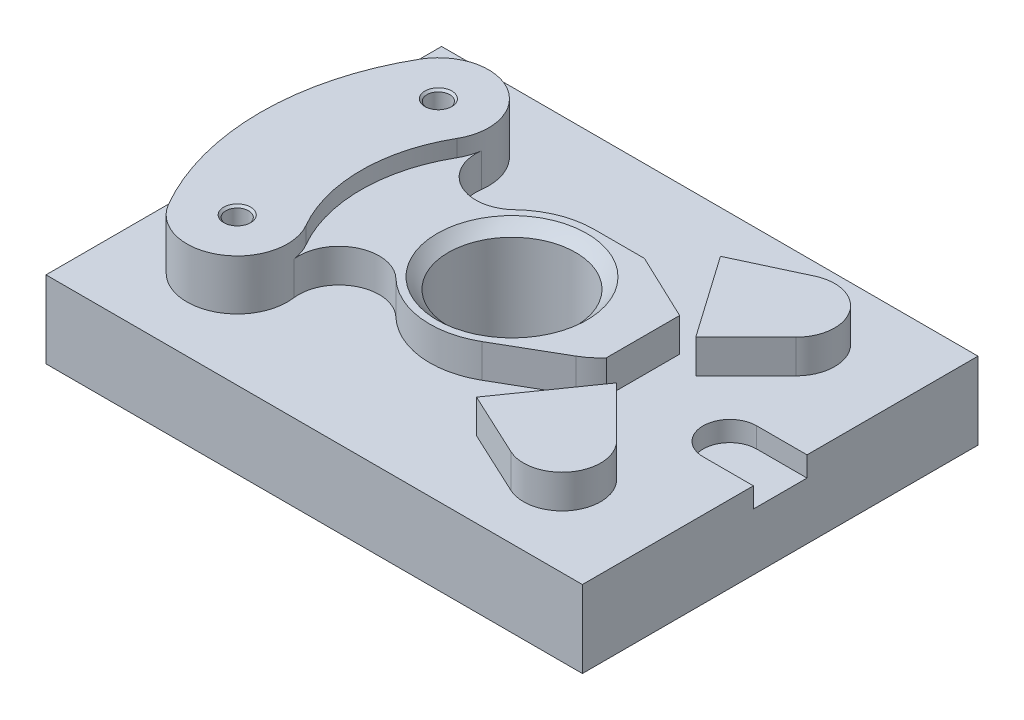
from build123d import *

# Parameters (mm, degrees)
SKETCH_1_W                   = 160
SKETCH_1_H                   = 118
EXTRUDE_1_DEPTH              = 23
EXTRUDE_2_DEPTH              = 38
HOLE_WIZARD_M8_2_D           = 6.8
HOLE_WIZARD_M8_2_DEPTH       = 17.957073895
HOLE_WIZARD_M8_2_CSINK_D     = 8.05
HOLE_WIZARD_M8_2_CSINK_ANGLE = 90
HOLE_WIZARD_M8_2_TIP         = 2.042926105
EXTRUDE_3_DEPTH              = 10
EXTRUDE_4_DEPTH              = 10
SKETCH_9_R                   = 19
CUT_EXTRUDE_1_DEPTH          = 105.737767782
CUT_EXTRUDE_2_DEPTH          = 6


with BuildPart() as part:
    # 草图1 → 凸台-拉伸1 (new body)
    with BuildSketch(Plane(origin=(0, 0, 0), x_dir=(1, 0, 0), z_dir=(0, 1, 0))):
        Rectangle(SKETCH_1_W, SKETCH_1_H)
    extrude(amount=EXTRUDE_1_DEPTH)

    # 草图1<3> → 凸台-拉伸2 (add)
    with BuildSketch(Plane(origin=(0, 0, 0), x_dir=(1, 0, 0), z_dir=(0, 1, 0))):
        with BuildLine():
            ThreePointArc((-38.97114317, 22.5), (-44.461524227, 42.990381057), (-64.951905284, 37.5))
            ThreePointArc((-64.951905284, 37.5), (-75, 0), (-64.951905284, -37.5))
            ThreePointArc((-64.951905284, -37.5), (-44.461524227, -42.990381057), (-38.97114317, -22.5))
            ThreePointArc((-38.97114317, -22.5), (-45, 0), (-38.97114317, 22.5))
        make_face()
    extrude(amount=EXTRUDE_2_DEPTH)

    # M8 螺纹孔2
    with Locations(Plane(origin=(0, 38, 0), x_dir=(1, 0, 0), z_dir=(0, 1, 0))):
        with Locations((-51.961524227, 30), (-51.961524227, -30)):
            CounterSinkHole(HOLE_WIZARD_M8_2_D / 2, HOLE_WIZARD_M8_2_CSINK_D / 2, depth=HOLE_WIZARD_M8_2_DEPTH, counter_sink_angle=HOLE_WIZARD_M8_2_CSINK_ANGLE)
            with Locations((0, 0, -(HOLE_WIZARD_M8_2_DEPTH + HOLE_WIZARD_M8_2_TIP / 2))):  # 118° drill point
                Cone(0, HOLE_WIZARD_M8_2_D / 2, HOLE_WIZARD_M8_2_TIP, mode=Mode.SUBTRACT)

    # 草图6 → 凸台-拉伸3 (add)
    with BuildSketch(Plane(origin=(0, 23, 0), x_dir=(1, 0, 0), z_dir=(0, 1, 0))):
        with BuildLine():
            Line((15, 24.5), (0, 24.5))
            ThreePointArc((0, 24.5), (-9.111917465, 22.742536361), (-16.916580755, 17.722282459))
            ThreePointArc((-16.916580755, 17.722282459), (-30.649129847, 15.709991673), (-37.095262413, 28.001435595))
            ThreePointArc((-37.095262413, 28.001435595), (-37.764179884, 25.158986305), (-38.97114317, 22.5))
            ThreePointArc((-38.97114317, 22.5), (-45, 0), (-38.97114317, -22.5))
            ThreePointArc((-38.97114317, -22.5), (-37.764179884, -25.158986305), (-37.095262413, -28.001435595))
            ThreePointArc((-37.095262413, -28.001435595), (-30.649129847, -15.709991673), (-16.916580755, -17.722282459))
            ThreePointArc((-16.916580755, -17.722282459), (-2.915234862, -24.325941003), (12.25, -21.217622393))
            Line((12.25, -21.217622393), (30, -10.969655115))
            ThreePointArc((30, -10.969655115), (32.66631784, -9.127014863), (35, -6.877903594))
            Line((35, -6.877903594), (35, 15))
            Line((35, 15), (15, 24.5))
        make_face()
    extrude(amount=EXTRUDE_3_DEPTH)

    # 草图8 → 凸台-拉伸4 (add)
    with BuildSketch(Plane(origin=(0, 23, 0), x_dir=(1, 0, 0), z_dir=(0, 1, 0))):
        with BuildLine():
            Line((25.800739315, 36.377490991), (43.008032405, 11.802929662))
            Line((43.008032405, 11.802929662), (57.971696229, 26.766593486))
            ThreePointArc((57.971696229, 26.766593486), (59.260216754, 41.494450487), (44.979858235, 45.32086102))
            Line((44.979858235, 45.32086102), (25.800739315, 36.377490991))
        make_face()
        with BuildLine():
            Line((43.008032405, -11.802929662), (57.971696229, -26.766593486))
            ThreePointArc((57.971696229, -26.766593486), (59.260216754, -41.494450487), (44.979858235, -45.32086102))
            Line((44.979858235, -45.32086102), (25.800739315, -36.377490991))
            Line((25.800739315, -36.377490991), (43.008032405, -11.802929662))
        make_face()
    extrude(amount=EXTRUDE_4_DEPTH)

    # 草图9 → 切除-拉伸1 (cut, through all)
    with BuildSketch(Plane(origin=(0, 33, 0), x_dir=(1, 0, 0), z_dir=(0, 1, 0))):
        Circle(SKETCH_9_R)
    extrude(amount=-CUT_EXTRUDE_1_DEPTH, mode=Mode.SUBTRACT)

    # 草图10 → 切除-旋转5 (revolve, cut)
    with BuildSketch(Plane.XY):
        with BuildLine():
            Line((0, 83), (0, 23))
            ThreePointArc((0, 23), (21.213203436, 31.786796564), (30, 53))
            ThreePointArc((30, 53), (21.213203436, 74.213203436), (0, 83))
        make_face()
    revolve(axis=Axis((0, 23, 0), (0, 1, 0)), mode=Mode.SUBTRACT)

    # 草图11 → 切除-拉伸2 (cut)
    with BuildSketch(Plane(origin=(0, 23, 0), x_dir=(1, 0, 0), z_dir=(0, 1, 0))):
        with BuildLine():
            Line((95, -8), (65, -8))
            ThreePointArc((65, -8), (57, 0), (65, 8))
            Line((65, 8), (95, 8))
            ThreePointArc((95, 8), (103, 0), (95, -8))
        make_face()
    extrude(amount=-CUT_EXTRUDE_2_DEPTH, mode=Mode.SUBTRACT)


solid = part.part
